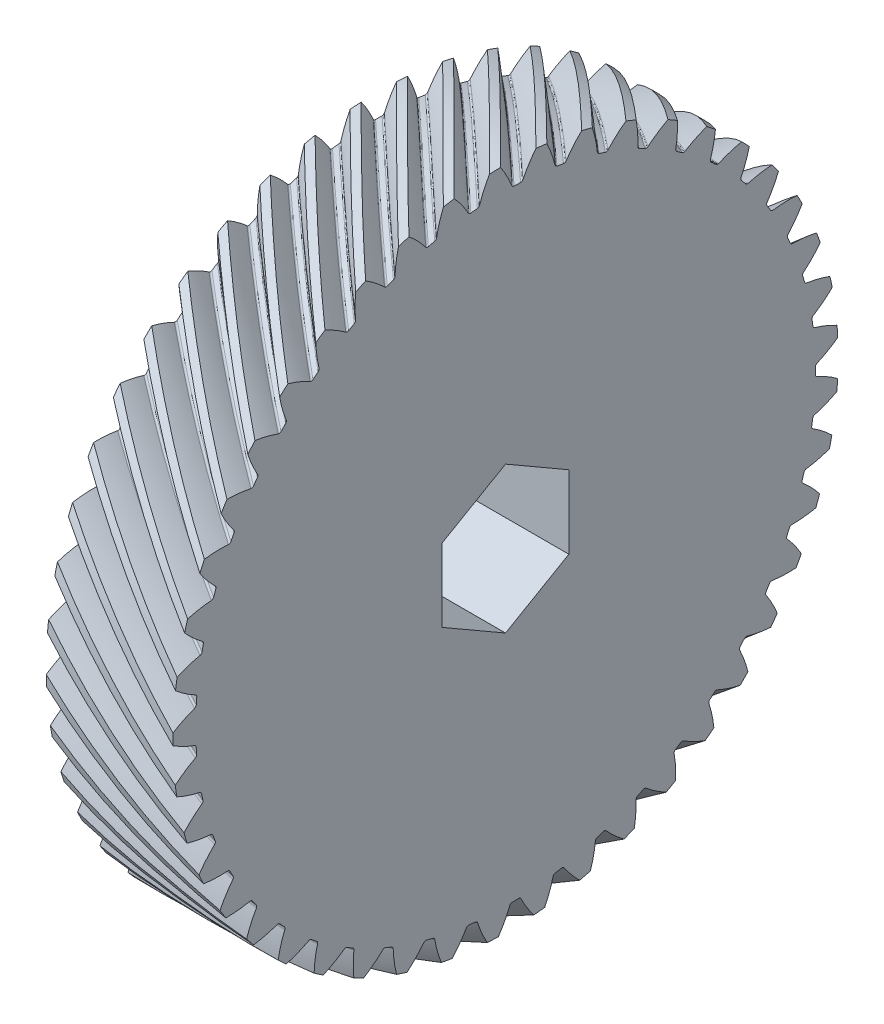
from build123d import *

# Parameters (mm, degrees)
BASPROSKE_W              = 5
BASPROSKE_H              = 13.127922061
TOOTHCUTRH_PITCH         = 82.48516701
TOOTHCUTRH_HEIGHT        = 5
TOOTHCUTRH_RADIUS        = 13.127922061
TOOTHCUTRH_START_ANGLE   = -90
TEETHCUTSRH_COUNT        = 45
TEETHCUTSRH_ANGLE        = 352
BORSKE_R                 = 2
BORE_DEPTH               = 62.5000025
TAGLIO_ESTRUSIONE1_DEPTH = 10


with BuildPart() as part:
    # BasProSke → Base-Revolve (revolve)
    with BuildSketch(Plane(origin=(0, 0, 0), x_dir=(1, 0, 0), z_dir=(0, 1, 0)), mode=Mode.PRIVATE) as base_revolve_sk:
        with Locations((2.5, 6.563961031)):
            Rectangle(BASPROSKE_W, BASPROSKE_H)
    revolve(base_revolve_sk.sketch.rotate(Axis((-10, 0, 0), (1, 0, 0)), 180), axis=Axis((-10, 0, 0), (1, 0, 0)))

    # ToothCutRH: sweep along a helix
    with BuildLine() as toothcutrh_path:
        add(Helix(TOOTHCUTRH_PITCH, TOOTHCUTRH_HEIGHT, TOOTHCUTRH_RADIUS, center=(0, 0, 0), direction=(1, 0, 0), mode=Mode.PRIVATE).rotate(Axis((0, 0, 0), (1, 0, 0)), TOOTHCUTRH_START_ANGLE))
    # TooCutSkeRH → ToothCutRH (sweep, cut)
    with BuildSketch(Plane(origin=(0, 0, 0), x_dir=(0, 0, -1), z_dir=(1, 0, 0))):
        with BuildLine():
            ThreePointArc((0.128911623, 12.227242524), (0, 12.227922061), (-0.128911623, 12.227242524))
            ThreePointArc((-0.128911623, 12.227242524), (-0.18451575, 12.243228324), (-0.22222329, 12.287108913))
            ThreePointArc((-0.22222329, 12.287108913), (-0.56569975, 12.917035476), (-1.004926796, 13.484365322))
            ThreePointArc((-1.004926796, 13.484365322), (0, 13.521759723), (1.004926796, 13.484365322))
            ThreePointArc((1.004926796, 13.484365322), (0.56569975, 12.917035476), (0.22222329, 12.287108913))
            ThreePointArc((0.22222329, 12.287108913), (0.18451575, 12.243228324), (0.128911623, 12.227242524))
        make_face()
    toothcutrh = sweep(path=toothcutrh_path.line, is_frenet=True, mode=Mode.SUBTRACT)

    # TeethCutsRH: ToothCutRH ×45 about axis
    teethcutsrh_axis = Axis((-10, 0, 0), (1, 0, 0))
    for i in range(1, TEETHCUTSRH_COUNT):
        add(toothcutrh.rotate(teethcutsrh_axis, i * TEETHCUTSRH_ANGLE / (TEETHCUTSRH_COUNT - 1)), mode=Mode.SUBTRACT)

    # BorSke → Bore (cut, symmetric)
    with BuildSketch(Plane(origin=(0, 0, 0), x_dir=(0, 0, -1), z_dir=(1, 0, 0))):
        with Locations(Location((0, 0, 0), (0, 0, 180))):
            Circle(BORSKE_R)
    extrude(amount=BORE_DEPTH, both=True, mode=Mode.SUBTRACT)

    # Schizzo1 → Taglio-Estrusione1 (cut)
    with BuildSketch(Plane(origin=(5, 0, 0), x_dir=(0, 0, -1), z_dir=(1, 0, 0))):
        Polygon((0, 2.886751346), (-2.5, 1.443375673), (-2.5, -1.443375673), (0, -2.886751346), (2.5, -1.443375673), (2.5, 1.443375673), align=None)
    extrude(amount=-TAGLIO_ESTRUSIONE1_DEPTH, mode=Mode.SUBTRACT)


solid = part.part
